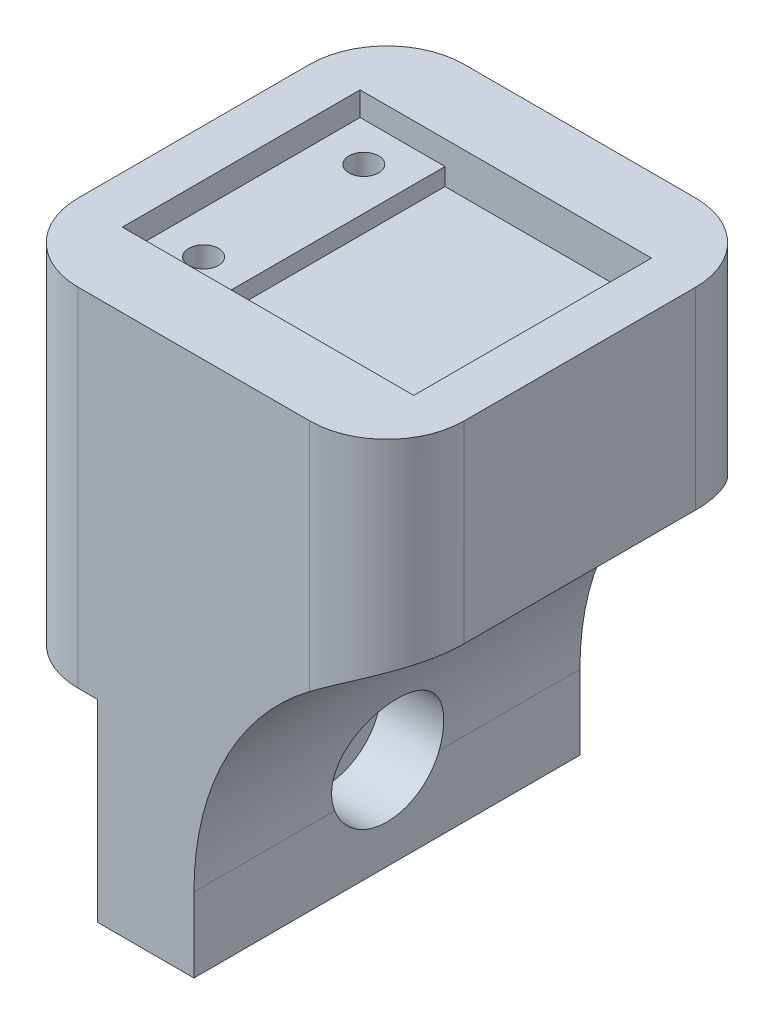
from build123d import *

# Parameters (mm, degrees)
PROFILE_W               = 12.7
PROFILE_H               = 22.86
PROFILE_W_2             = 6.35
PROFILE_H_2             = 12.7
BOSS_EXTRUDE1_DEPTH     = 12.7
CUT_EXTRUDE1_DEPTH      = 27.910817528
CUT_EXTRUDE1_DEPTH_BACK = 27.910817528
SCREWHOLE_R             = 2.159
CUT_EXTRUDE2_START      = -4.064
SKETCH3_R               = 3.683
SKETCH3_R_2             = 2.159
CUT_EXTRUDE2_DEPTH      = 4.064
SKETCH4_W               = 25.4
SKETCH4_H               = 12.7
BOSS_EXTRUDE2_DEPTH     = 12.7
SKETCH6_W               = 19.177
SKETCH6_H               = 15.6464
CUT_EXTRUDE3_DEPTH      = 1.5748
SKETCH9_W               = 13.589
SKETCH9_H               = 15.6464
CUT_EXTRUDE5_DEPTH      = 1.143
SKETCH7_R               = 0.9779
CUT_EXTRUDE6_DEPTH      = 12.7
FILLET1_R               = 19.05
FILLET2_R               = 5.08


with BuildPart() as part:
    # Profile → Boss-Extrude1 (new, symmetric)
    with BuildSketch(Plane.XY):
        with Locations((0, 11.43)):
            Rectangle(PROFILE_W, PROFILE_H)
        with Locations((3.175, -6.35)):
            Rectangle(PROFILE_W_2, PROFILE_H_2)
    extrude(amount=BOSS_EXTRUDE1_DEPTH, both=True)

    # ScrewHole → Cut-Extrude1 (cut, two sides: drawn at the far end of the back side and taken through both)
    with BuildSketch(Plane.ZY.offset(-CUT_EXTRUDE1_DEPTH_BACK)):
        with Locations(Location((0, -6.477, 0), (0, 0, 270))):
            Circle(SCREWHOLE_R)
    extrude(amount=CUT_EXTRUDE1_DEPTH + CUT_EXTRUDE1_DEPTH_BACK, mode=Mode.SUBTRACT)

    # Sketch3 → Cut-Extrude2 (cut)
    with BuildSketch(Plane(origin=(6.35, 0, 0), x_dir=(0, 0, -1), z_dir=(1, 0, 0)).offset(CUT_EXTRUDE2_START)):
        with Locations(Location((0, -6.477, 0), (0, 0, 90))):
            Circle(SKETCH3_R)
        with Locations(Location((0, -6.477, 0), (0, 0, 270))):
            Circle(SKETCH3_R_2, mode=Mode.SUBTRACT)
    extrude(amount=CUT_EXTRUDE2_DEPTH, mode=Mode.SUBTRACT)

    # Sketch4 → Boss-Extrude2 (add)
    with BuildSketch(Plane(origin=(6.35, 0, 0), x_dir=(0, 0, -1), z_dir=(1, 0, 0))):
        with Locations((0, 16.51)):
            Rectangle(SKETCH4_W, SKETCH4_H)
    extrude(amount=BOSS_EXTRUDE2_DEPTH)

    # Sketch6 → Cut-Extrude3 (cut)
    with BuildSketch(Plane(origin=(0, 22.86, 0), x_dir=(1, 0, 0), z_dir=(0, 1, 0))):
        with Locations((6.35, 0)):
            Rectangle(SKETCH6_W, SKETCH6_H)
    extrude(amount=-CUT_EXTRUDE3_DEPTH, mode=Mode.SUBTRACT)

    # Sketch9 → Cut-Extrude5 (cut)
    with BuildSketch(Plane(origin=(0, 21.2852, 0), x_dir=(1, 0, 0), z_dir=(0, 1, 0))):
        with Locations((9.144, 0)):
            Rectangle(SKETCH9_W, SKETCH9_H)
    extrude(amount=-CUT_EXTRUDE5_DEPTH, mode=Mode.SUBTRACT)

    # Sketch7 → Cut-Extrude6 (cut)
    with BuildSketch(Plane(origin=(0, 21.2852, 0), x_dir=(1, 0, 0), z_dir=(0, 1, 0))):
        with Locations(Location((-0.4445, -5.2705, 0), (0, 0, 90))):
            Circle(SKETCH7_R)
        with Locations(Location((-0.4445, 5.2705, 0), (0, 0, 90))):
            Circle(SKETCH7_R)
    extrude(amount=-CUT_EXTRUDE6_DEPTH, mode=Mode.SUBTRACT)

    # Fillet1
    # the kernel refuses this fillet: 19.05 mm, written as the material it adds along each edge
    with BuildSketch(Plane(origin=(6.35, 10.16, -12.7), x_dir=(0, -1, 0), z_dir=(0, 0, 1))) as fillet1_piece_1_section:
        with BuildLine():
            CenterArc((17.960512242, 19.05), FILLET1_R, 199.471220634, 70.528779366)
            Line((0, 12.7), (0, 0))
            Line((0, 0), (17.960512242, 0))
        make_face()
    fillet1_piece_1 = extrude(amount=25.4, mode=Mode.PRIVATE)
    fillet1_piece_1 = fillet1_piece_1 - Plane(origin=(6.35, -6.477, 0), x_dir=(0, 1, 0), z_dir=(-1, 0, 0)) * Cylinder(3.683, 123, mode=Mode.PRIVATE)
    add(fillet1_piece_1)

    # Fillet2
    fillet2_edges = [part.edges().sort_by_distance(p)[0] for p in [
        (-6.35, 11.43, 12.7),
        (19.05, 16.51, 12.7),
        (19.05, 16.51, -12.7),
        (-6.35, 11.43, -12.7),
    ]]
    fillet(fillet2_edges, radius=FILLET2_R)


solid = part.part
